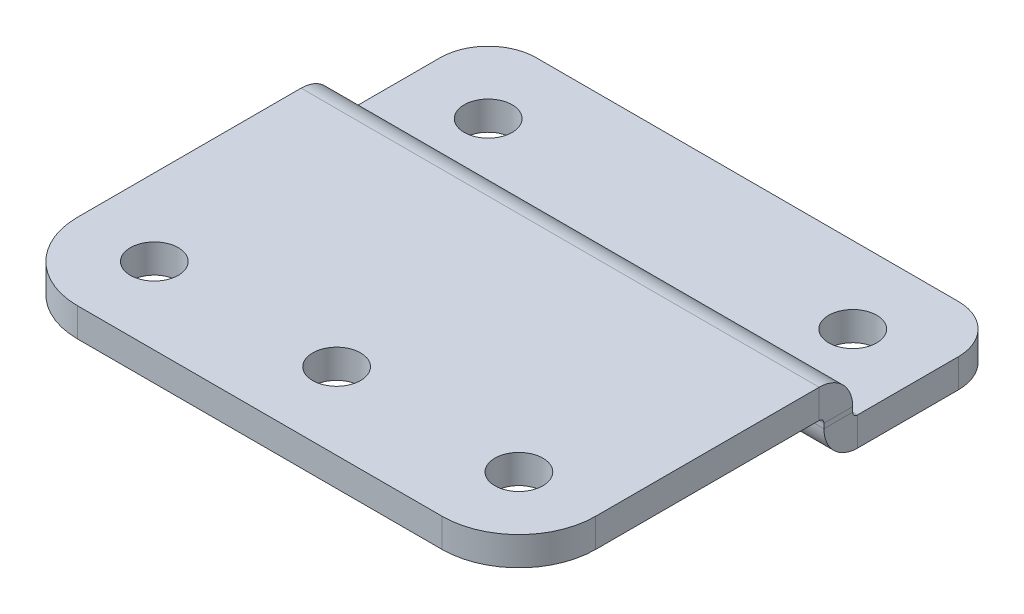
from build123d import *

# Parameters (mm, degrees)
SKETCH1_R                    = 2.5
BASE_FLANGE1_DEPTH           = 3
EDGE_FLANGE1_STRIP_W         = 13
EDGE_FLANGE1_STRIP_H         = 3
EDGE_FLANGE1_STRIP_CUT_DEPTH = 54
EDGE_FLANGE1_DEPTH           = 54
EDGE_FLANGE2_DEPTH           = 54
SKETCH25_R                   = 2.5
CUT_EXTRUDE1_DEPTH           = 65.67835805


# Sheet-metal steps are written as plain solids
with BuildPart() as part:
    # Sketch1 → Base-Flange1 (new body)
    with BuildSketch(Plane(origin=(0, 0, 0), x_dir=(1, 0, 0), z_dir=(0, 1, 0))):
        with BuildLine():
            Line((0, 0), (54, 0))
            Line((54, 0), (54, 11))
            ThreePointArc((54, 11), (52.535533906, 14.535533906), (49, 16))
            Line((49, 16), (5, 16))
            ThreePointArc((5, 16), (1.464466094, 14.535533906), (0, 11))
            Line((0, 11), (0, 0))
        make_face()
        with Locations(Location((8, 8, 0), (0, 0, 270))):
            Circle(SKETCH1_R, mode=Mode.SUBTRACT)
        with Locations(Location((46, 8, 0), (0, 0, 90))):
            Circle(SKETCH1_R, mode=Mode.SUBTRACT)
    extrude(amount=-BASE_FLANGE1_DEPTH)

    # Edge-Flange1 strip (across the edge) → Edge-Flange1 strip cut (cut)
    with BuildSketch(Plane(origin=(0, 0, 0), x_dir=(0, 0, -1), z_dir=(1, 0, 0))):
        with Locations((-6, -1.5)):
            Rectangle(EDGE_FLANGE1_STRIP_W, EDGE_FLANGE1_STRIP_H)
    extrude(amount=EDGE_FLANGE1_STRIP_CUT_DEPTH, mode=Mode.SUBTRACT)

    # Edge-Flange1 section (across the edge) → Edge-Flange1 (add)
    with BuildSketch(Plane(origin=(0, 0, 0), x_dir=(0, 0, -1), z_dir=(1, 0, 0))):
        with BuildLine():
            Line((-3, 0.5), (-3, 1))
            Line((-3, 1), (0, 1))
            Line((0, 1), (0, 0.5))
            ThreePointArc((0, 0.5), (0.146446609, 0.146446609), (0.5, 0))
            Line((0.5, 0), (0.5, -3))
            ThreePointArc((0.5, -3), (-1.974873734, -1.974873734), (-3, 0.5))
        make_face()
    extrude(amount=EDGE_FLANGE1_DEPTH)

    # Edge-Flange2 section (across the edge) → Edge-Flange2 (add)
    with BuildSketch(Plane(origin=(54, 1.5, 3), x_dir=(0, -1, 0), z_dir=(-1, 0, 0))):
        with BuildLine():
            Line((-3, 0.5), (-3, 31.8))
            Line((-3, 31.8), (0, 31.8))
            Line((0, 31.8), (0, 0.5))
            ThreePointArc((0, 0.5), (0.146446609, 0.146446609), (0.5, 0))
            Line((0.5, 0), (0.5, -3))
            ThreePointArc((0.5, -3), (-1.974873734, -1.974873734), (-3, 0.5))
        make_face()
    extrude(amount=EDGE_FLANGE2_DEPTH)

    # Sketch25 → Cut-Extrude1 (cut, through all)
    with BuildSketch(Plane(origin=(0, 4.5, 0), x_dir=(1, 0, 0), z_dir=(0, 1, 0))):
        with Locations(Location((27, -26.8, 0), (0, 0, 270))):
            Circle(SKETCH25_R)
        with Locations(Location((8, -26.8, 0), (0, 0, 270))):
            Circle(SKETCH25_R)
        with BuildLine():
            ThreePointArc((8, -34.8), (2.343145751, -32.456854249), (0, -26.8))
            Line((0, -26.8), (0, -34.8))
            Line((0, -34.8), (8, -34.8))
        make_face()
        with Locations(Location((46, -26.8, 0), (0, 0, 270))):
            Circle(SKETCH25_R)
        with BuildLine():
            Line((54, -34.8), (54, -26.8))
            ThreePointArc((54, -26.8), (51.656854249, -32.456854249), (46, -34.8))
            Line((46, -34.8), (54, -34.8))
        make_face()
    extrude(amount=-CUT_EXTRUDE1_DEPTH, mode=Mode.SUBTRACT)


solid = part.part
